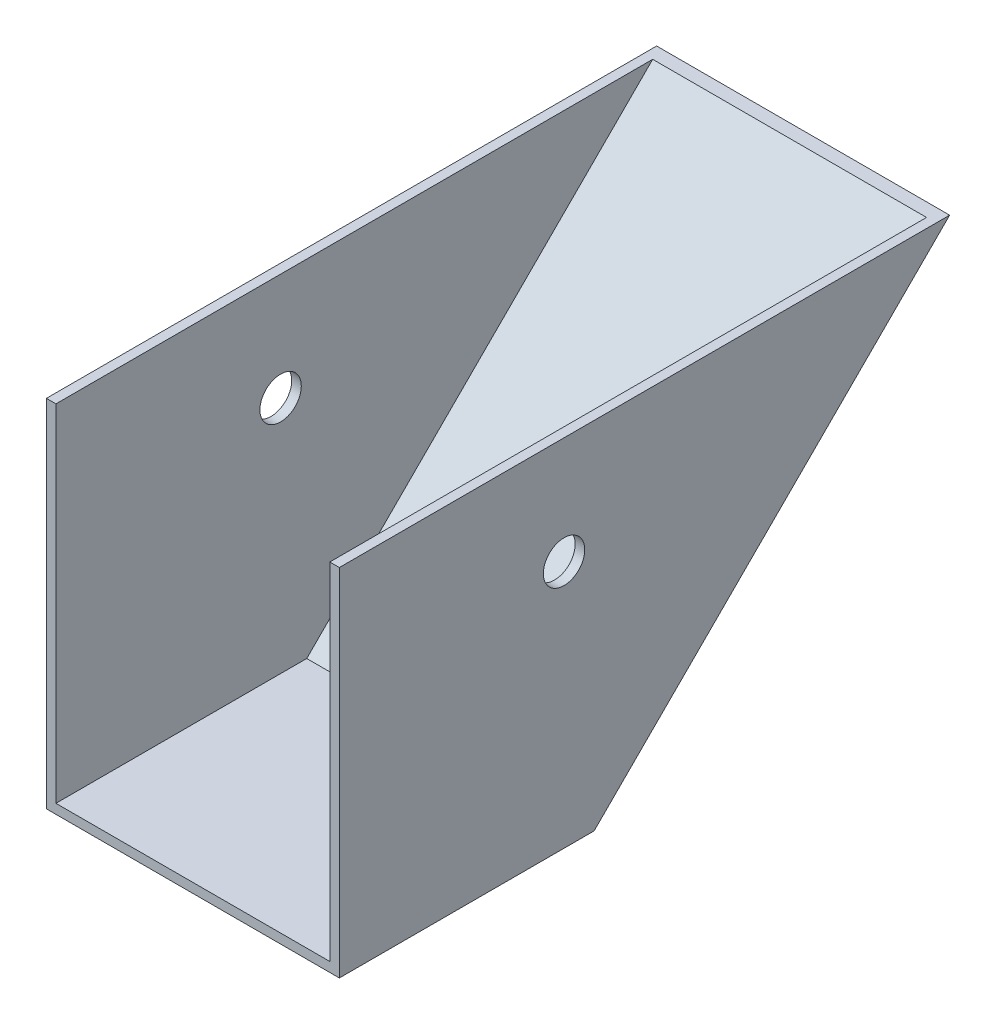
from build123d import *

# Parameters (mm, degrees)
SKETCH2_W           = 292.1
SKETCH2_H           = 635
BOSS_EXTRUDE1_DEPTH = 190.5
CUT_EXTRUDE2_DEPTH  = 381
SHELL1_T            = -9.525
SKETCH5_W           = 292.1
SKETCH5_H           = 635
CUT_EXTRUDE3_DEPTH  = 24.892
SKETCH6_R           = 20.6375
CUT_EXTRUDE4_DEPTH  = 514.096
SKETCH10_W          = 292.1
SKETCH10_H          = 610.108
CUT_EXTRUDE7_DEPTH  = 1.693333333


with BuildPart() as part:
    # Sketch2 → Boss-Extrude1 (new, symmetric)
    with BuildSketch(Plane(origin=(0, 0, 0), x_dir=(1, 0, 0), z_dir=(0, 1, 0))):
        Rectangle(SKETCH2_W, SKETCH2_H)
    extrude(amount=BOSS_EXTRUDE1_DEPTH, both=True)

    # Sketch4 → Cut-Extrude2 (cut)
    with BuildSketch(Plane.ZY.offset(146.05)):
        Polygon((-317.5, 190.5), (63.5, -190.5), (-317.5, -190.5), align=None)
    extrude(amount=-CUT_EXTRUDE2_DEPTH, mode=Mode.SUBTRACT)

    # Shell1
    shell1_openings = [part.faces().sort_by_distance(p)[0] for p in [
        (0, 0, 317.5),
    ]]
    offset(amount=SHELL1_T, openings=shell1_openings, kind=Kind.INTERSECTION)

    # Sketch5 → Cut-Extrude3 (cut)
    with BuildSketch(Plane(origin=(0, 190.5, 0), x_dir=(1, 0, 0), z_dir=(0, 1, 0))):
        Rectangle(SKETCH5_W, SKETCH5_H)
    extrude(amount=-CUT_EXTRUDE3_DEPTH, mode=Mode.SUBTRACT)

    # Sketch6 → Cut-Extrude4 (cut)
    with BuildSketch(Plane.ZY.offset(146.05)):
        with Locations((93.517292524, 56.961208915)):
            Circle(SKETCH6_R)
    extrude(amount=-CUT_EXTRUDE4_DEPTH, mode=Mode.SUBTRACT)

    # Sketch10 → Cut-Extrude7 (cut)
    with BuildSketch(Plane(origin=(0, 165.608, 0), x_dir=(1, 0, 0), z_dir=(0, 1, 0))):
        with Locations((0, -12.446)):
            Rectangle(SKETCH10_W, SKETCH10_H)
    extrude(amount=-CUT_EXTRUDE7_DEPTH, mode=Mode.SUBTRACT)


solid = part.part
